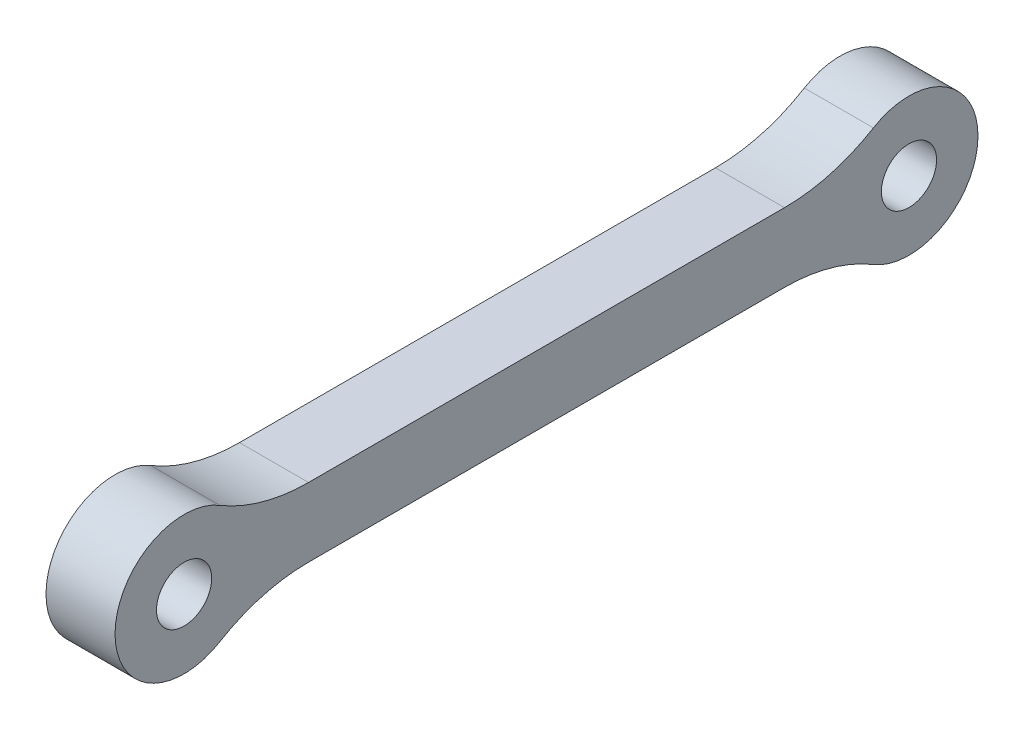
from build123d import *

# Parameters (mm, degrees)
SKETCH1_R           = 1.6
BOSS_EXTRUDE1_DEPTH = 4
FILLET1_R           = 10


with BuildPart() as part:
    # Sketch1 → Boss-Extrude1 (new body)
    with BuildSketch(Plane(origin=(0, 0, 0), x_dir=(0, 0, -1), z_dir=(1, 0, 0))):
        with BuildLine():
            Line((21, 2), (38.535898385, 2))
            ThreePointArc((38.535898385, 2), (46, 0), (38.535898385, -2))
            Line((38.535898385, -2), (21, -2))
            Line((21, -2), (3.464101615, -2))
            ThreePointArc((3.464101615, -2), (-4, 0), (3.464101615, 2))
            Line((3.464101615, 2), (21, 2))
        make_face()
        Circle(SKETCH1_R, mode=Mode.SUBTRACT)
        with Locations((42, 0)):
            Circle(SKETCH1_R, mode=Mode.SUBTRACT)
    extrude(amount=BOSS_EXTRUDE1_DEPTH)

    # Fillet1
    fillet1_edges = [part.edges().sort_by_distance(p)[0] for p in [
        (2, 2, -3.464101615),
        (2, -2, -3.464101615),
        (2, -2, -38.535898385),
        (2, 2, -38.535898385),
    ]]
    fillet(fillet1_edges, radius=FILLET1_R)


solid = part.part
